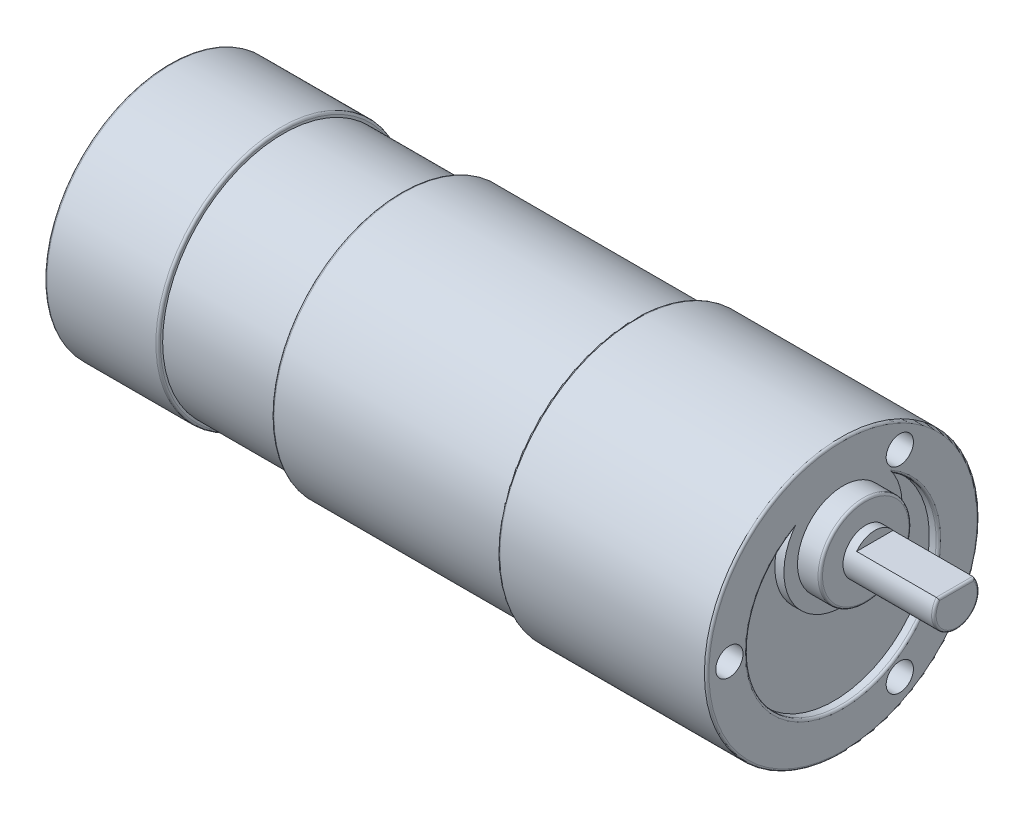
from build123d import *

# Parameters (mm, degrees)
SKETCH1_R           = 15
BOSS_EXTRUDE1_DEPTH = 76.6
SKETCH2_R           = 2.5
BOSS_EXTRUDE2_DEPTH = 10
CUT_EXTRUDE1_START  = -9
CUT_EXTRUDE1_DEPTH  = 9
CUT_EXTRUDE2_START  = -2.5
SKETCH6_R           = 15
SKETCH6_R_2         = 5
CUT_EXTRUDE2_DEPTH  = 2.5
CUT_EXTRUDE3_DEPTH  = 1
SKETCH8_R           = 1.5
CUT_EXTRUDE4_DEPTH  = 4
FILLET1_R           = 0.25


with BuildPart() as part:
    # Sketch1 → Boss-Extrude1 (new body)
    with BuildSketch(Plane(origin=(0, 0, 0), x_dir=(0, 0, -1), z_dir=(1, 0, 0))):
        Circle(SKETCH1_R)
    extrude(amount=BOSS_EXTRUDE1_DEPTH)

    # Sketch2 → Boss-Extrude2 (add)
    with BuildSketch(Plane(origin=(76.6, 0, 0), x_dir=(0, 0, -1), z_dir=(1, 0, 0))):
        with Locations((0, 5.5)):
            Circle(SKETCH2_R)
    extrude(amount=BOSS_EXTRUDE2_DEPTH)

    # Sketch4 → Cut-Extrude1 (cut)
    with BuildSketch(Plane(origin=(86.6, 0, 0), x_dir=(0, 0, -1), z_dir=(1, 0, 0)).offset(CUT_EXTRUDE1_START)):
        with BuildLine():
            Line((-2, 7), (2, 7))
            ThreePointArc((2, 7), (0, 8), (-2, 7))
        make_face()
    extrude(amount=CUT_EXTRUDE1_DEPTH, mode=Mode.SUBTRACT)

    # Sketch5 → Cut-Revolve1 (revolve, cut)
    with BuildSketch(Plane.XY, mode=Mode.PRIVATE) as cut_revolve1_sk:
        Polygon((0, 13.75), (12.5, 13.75), (12.5, 13.25), (25.5, 13.25), (25.5, 14.25), (51.1, 14.25), (51.1, 15), (0, 15), align=None)
    revolve(cut_revolve1_sk.sketch.rotate(Axis((-4.33, 0, 0), (1, 0, 0)), 90), axis=Axis((-4.33, 0, 0), (1, 0, 0)), mode=Mode.SUBTRACT)

    # Sketch6 → Cut-Extrude2 (cut)
    with BuildSketch(Plane(origin=(76.6, 0, 0), x_dir=(0, 0, -1), z_dir=(1, 0, 0)).offset(CUT_EXTRUDE2_START)):
        with Locations(Location((0, 0, 0), (0, 0, 180))):
            Circle(SKETCH6_R)
        with Locations((0, 5.5)):
            Circle(SKETCH6_R_2, mode=Mode.SUBTRACT)
    extrude(amount=CUT_EXTRUDE2_DEPTH, mode=Mode.SUBTRACT)

    # Sketch7 → Cut-Extrude3 (cut)
    with BuildSketch(Plane(origin=(74.1, 0, 0), x_dir=(0, 0, -1), z_dir=(1, 0, 0))):
        with BuildLine():
            ThreePointArc((-5.520201443, 8.931818182), (-5.113114748, -9.17093548), (10.5, 0))
            ThreePointArc((10.5, 0), (9.17093548, 5.113114748), (5.520201443, 8.931818182))
            ThreePointArc((5.520201443, 8.931818182), (6.25025237, 7.284473399), (6.5, 5.5))
            ThreePointArc((6.5, 5.5), (-1.784473399, -0.75025237), (-5.520201443, 8.931818182))
        make_face()
    extrude(amount=-CUT_EXTRUDE3_DEPTH, mode=Mode.SUBTRACT)

    # Sketch8 → Cut-Extrude4 (cut)
    with BuildSketch(Plane(origin=(74.1, 0, 0), x_dir=(0, 0, -1), z_dir=(1, 0, 0))):
        with Locations((6.25, 10.825317547)):
            Circle(SKETCH8_R)
        with Locations((6.25, -10.825317547)):
            Circle(SKETCH8_R)
        with Locations((-12.5, 0)):
            Circle(SKETCH8_R)
    extrude(amount=-CUT_EXTRUDE4_DEPTH, mode=Mode.SUBTRACT)

    # Fillet1
    # the kernel refuses this fillet: 0.25 mm, written as the material it takes off along each edge
    with BuildSketch(Plane(origin=(86.6, 7, 2.625), x_dir=(0, -1, 0), z_dir=(0, 0, -1))) as fillet1_piece_1:
        with BuildLine():
            CenterArc((FILLET1_R, FILLET1_R), FILLET1_R, 180, 90)
            Line((0, FILLET1_R), (0, 0))
            Line((0, 0), (FILLET1_R, 0))
        make_face()
    extrude(amount=5.25, mode=Mode.SUBTRACT)
    with BuildSketch(Plane(origin=(0, 0, 0), x_dir=(0, 0, 1), z_dir=(0, 1, 0))) as fillet1_piece_2:
        with BuildLine():
            CenterArc((13.75 - FILLET1_R, FILLET1_R), FILLET1_R, 270, 90)
            Line((13.75 - FILLET1_R, 0), (13.75, 0))
            Line((13.75, 0), (13.75, FILLET1_R))
        make_face()
    revolve(axis=Axis((0, 0, 0), (1, 0, 0)), mode=Mode.SUBTRACT)
    with BuildSketch(Plane(origin=(12.5, 0, 0), x_dir=(0, 0, 1), z_dir=(0, 1, 0))) as fillet1_piece_3:
        with BuildLine():
            CenterArc((13.75 - FILLET1_R, -FILLET1_R), FILLET1_R, 0, 90)
            Line((13.75, -FILLET1_R), (13.75, 0))
            Line((13.75, 0), (13.75 - FILLET1_R, 0))
        make_face()
    revolve(axis=Axis((12.5, 0, 0), (1, 0, 0)), mode=Mode.SUBTRACT)
    with BuildSketch(Plane(origin=(25.5, 0, 0), x_dir=(0, 0, 1), z_dir=(0, 1, 0))) as fillet1_piece_4:
        with BuildLine():
            CenterArc((14.25 - FILLET1_R, FILLET1_R), FILLET1_R, 270, 90)
            Line((14.25 - FILLET1_R, 0), (14.25, 0))
            Line((14.25, 0), (14.25, FILLET1_R))
        make_face()
    revolve(axis=Axis((25.5, 0, 0), (1, 0, 0)), mode=Mode.SUBTRACT)
    with BuildSketch(Plane(origin=(51.1, 0, 0), x_dir=(0, 0, -1), z_dir=(0, -1, 0))) as fillet1_piece_5:
        with BuildLine():
            CenterArc((15 - FILLET1_R, FILLET1_R), FILLET1_R, 270, 90)
            Line((15 - FILLET1_R, 0), (15, 0))
            Line((15, 0), (15, FILLET1_R))
        make_face()
    revolve(axis=Axis((51.1, 0, 0), (1, 0, 0)), mode=Mode.SUBTRACT)
    with BuildSketch(Plane(origin=(74.1, 0, 0), x_dir=(0, 0, -1), z_dir=(0, 1, 0))) as fillet1_piece_6:
        with BuildLine():
            CenterArc((15 - FILLET1_R, FILLET1_R), FILLET1_R, 270, 90)
            Line((15 - FILLET1_R, 0), (15, 0))
            Line((15, 0), (15, FILLET1_R))
        make_face()
    revolve(axis=Axis((74.1, 0, 0), (-1, 0, 0)), mode=Mode.SUBTRACT)
    with BuildSketch(Plane(origin=(76.6, 5.5, 0), x_dir=(0, 0, -1), z_dir=(0, -1, 0))) as fillet1_piece_7:
        with BuildLine():
            CenterArc((5 - FILLET1_R, -FILLET1_R), FILLET1_R, 0, 90)
            Line((5 - FILLET1_R, 0), (5, 0))
            Line((5, 0), (5, -FILLET1_R))
        make_face()
    revolve(axis=Axis((76.6, 5.5, 0), (1, 0, 0)), mode=Mode.SUBTRACT)
    with BuildSketch(Plane(origin=(74.1, 0, 0), x_dir=(0, 0.8804976199677298, 0.47405056822153846), z_dir=(0, 0.47405056822153846, -0.8804976199677298))) as fillet1_piece_8_section:
        with BuildLine():
            CenterArc((10.5 + FILLET1_R, -FILLET1_R), FILLET1_R, 90, 90)
            Line((10.5, -FILLET1_R), (10.5, 0))
            Line((10.5, 0), (10.5 + FILLET1_R, 0))
        make_face()
    fillet1_piece_8 = revolve(axis=Axis((74.1, 0, 0), (1, 0, 0)), revolution_arc=241.702449394, mode=Mode.PRIVATE)
    fillet1_piece_8 = fillet1_piece_8 - Plane(origin=(74.032708533, 5.5, 0), x_dir=(0, 0.5279720279720663, -0.8492617604007988), z_dir=(1, 0, 0)) * Cylinder(6.5, 44, mode=Mode.PRIVATE)
    add(fillet1_piece_8, mode=Mode.SUBTRACT)
    with BuildSketch(Plane(origin=(86.6, 5.5, 0), x_dir=(0, 0.7796364213611253, 0.6262324252920938), z_dir=(0, 0.6262324252920938, -0.7796364213611253))) as fillet1_piece_9:
        with BuildLine():
            CenterArc((2.5 - FILLET1_R, -FILLET1_R), FILLET1_R, 0, 90)
            Line((2.5 - FILLET1_R, 0), (2.5, 0))
            Line((2.5, 0), (2.5, -FILLET1_R))
        make_face()
    revolve(axis=Axis((86.6, 5.5, 0), (1, 0, 0)), revolution_arc=231.227298529, mode=Mode.SUBTRACT)
    with BuildSketch(Plane(origin=(86.6, 5.5, 0), x_dir=(0, 0, -1), z_dir=(0, -1, 0))) as fillet1_piece_10:
        with BuildLine():
            CenterArc((2.5 - FILLET1_R, -FILLET1_R), FILLET1_R, 0, 90)
            Line((2.5 - FILLET1_R, 0), (2.5, 0))
            Line((2.5, 0), (2.5, -FILLET1_R))
        make_face()
    revolve(axis=Axis((86.6, 5.5, 0), (1, 0, 0)), revolution_arc=51.194807976, mode=Mode.SUBTRACT)
    with BuildSketch(Plane(origin=(74.1, 0, 0), x_dir=(0, 0, -1), z_dir=(0, -1, 0))) as fillet1_piece_11_section:
        with BuildLine():
            CenterArc((10.5 + FILLET1_R, -FILLET1_R), FILLET1_R, 90, 90)
            Line((10.5, -FILLET1_R), (10.5, 0))
            Line((10.5, 0), (10.5 + FILLET1_R, 0))
        make_face()
    fillet1_piece_11 = revolve(axis=Axis((74.1, 0, 0), (1, 0, 0)), revolution_arc=61.693404227, mode=Mode.PRIVATE)
    fillet1_piece_11 = fillet1_piece_11 - Plane(origin=(74.03049628, 5.5, 0), x_dir=(0, 0.5279720279720663, -0.8492617604007988), z_dir=(1, 0, 0)) * Cylinder(6.5, 44, mode=Mode.PRIVATE)
    add(fillet1_piece_11, mode=Mode.SUBTRACT)


solid = part.part
